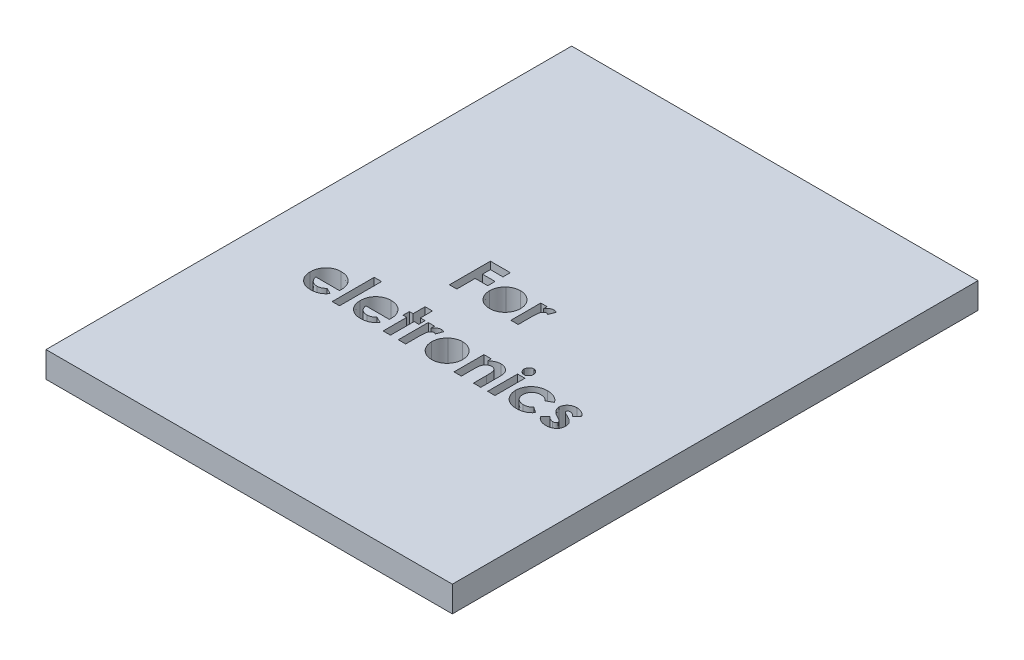
from build123d import *

# Parameters (mm, degrees)
SKETCH1_W           = 63
SKETCH1_H           = 81.5
BOSS_EXTRUDE1_DEPTH = 4
SKETCH2_W           = 1.13974359
SKETCH2_H           = 6.512820513
SKETCH2_H_2         = 4.640384616
CUT_EXTRUDE1_DEPTH  = 104.088554166


with BuildPart() as part:
    # Sketch1 → Boss-Extrude1 (new body)
    with BuildSketch(Plane(origin=(0, 0, 0), x_dir=(1, 0, 0), z_dir=(0, 1, 0))):
        with Locations((-31.5, 40.75)):
            Rectangle(SKETCH1_W, SKETCH1_H)
    extrude(amount=BOSS_EXTRUDE1_DEPTH)

    # Sketch2 → Cut-Extrude1 (cut, through all)
    # profile 1 of 14: a face of its own
    with BuildSketch(Plane(origin=(0, 4, 0), x_dir=(1, 0, 0), z_dir=(0, 1, 0))):
        Polygon((-40.419870072, 46.317161779), (-37.326280328, 46.317161779), (-37.326280328, 45.17741819), (-39.280126482, 45.17741819), (-39.280126482, 43.956264344), (-37.326280328, 43.956264344), (-37.326280328, 42.816520754), (-39.280126482, 42.816520754), (-39.280126482, 39.967161779), (-40.419870072, 39.967161779), align=None)
    # profile 2 of 14: a face of its own
    with BuildSketch(Plane(origin=(0, 4, 0), x_dir=(1, 0, 0), z_dir=(0, 1, 0))):
        with BuildLine():
            add(Edge.make_bspline(
                [(-34.138559975, 44.688956651), (-34.084675099, 44.687997733), (-33.977958627, 44.68609864), (-33.819017773, 44.670290428), (-33.662855572, 44.644498679), (-33.508574424, 44.611102865), (-33.357606973, 44.564310335), (-33.209161415, 44.50818993), (-33.061910456, 44.443757143), (-32.919508836, 44.367059589), (-32.780927811, 44.283874096), (-32.649544751, 44.192113673), (-32.526450703, 44.092499066), (-32.409360622, 43.987339917), (-32.303731094, 43.872057941), (-32.202811827, 43.752207907), (-32.112055243, 43.623496006), (-32.028027719, 43.48905865), (-31.953218619, 43.349673263), (-31.888260673, 43.20630946), (-31.831883284, 43.060949347), (-31.787740918, 42.911822339), (-31.751195108, 42.760894872), (-31.728132104, 42.606317444), (-31.711735907, 42.449677953), (-31.709897374, 42.344215358), (-31.708972636, 42.291170193)],
                knots=[0, 0, 0, 0, 1.022364134, 2.024744242, 3.027414945, 4.024939316, 5.017584196, 6.023349371, 7.035562955, 8.064994934, 9.090267829, 10.101425541, 11.102933353, 12.093946398, 13.084502048, 14.067315274, 15.065326281, 16.070028806, 17.074376865, 18.064572984, 19.055292013, 20.030201733, 21.013838017, 21.999348303, 22.993720005, 24, 24, 24, 24], degree=3))
            add(Edge.make_bspline(
                [(-31.708972636, 42.291170193), (-31.709948544, 42.237710612), (-31.71188887, 42.131420847), (-31.72753891, 41.973307969), (-31.753429382, 41.818003635), (-31.78695337, 41.664592923), (-31.83357079, 41.515038867), (-31.888038268, 41.367136984), (-31.954899241, 41.22290323), (-32.028818973, 41.080764152), (-32.113386758, 40.944902469), (-32.204064783, 40.814901185), (-32.30456135, 40.694170846), (-32.409345284, 40.578967267), (-32.523386723, 40.473186119), (-32.644865352, 40.375109797), (-32.772729505, 40.283539274), (-32.90789866, 40.200622968), (-33.048641525, 40.127767367), (-33.192584498, 40.062082097), (-33.340569278, 40.007394419), (-33.492289602, 39.962798124), (-33.647837484, 39.928268329), (-33.806869514, 39.904811829), (-33.969043195, 39.888498103), (-34.078309436, 39.886672944), (-34.133471834, 39.885751523)],
                knots=[0, 0, 0, 0, 1.012026251, 2.012137606, 3.004615893, 3.992048833, 4.982446996, 5.968083444, 6.973977695, 7.990229942, 8.999482246, 10.001782172, 10.988562221, 11.971415814, 12.948383116, 13.930088534, 14.925840678, 15.924049238, 16.929462851, 17.924729459, 18.917889337, 19.913673841, 20.916777188, 21.931792057, 22.95587778, 24, 24, 24, 24], degree=3))
            add(Edge.make_bspline(
                [(-34.133471834, 39.885751523), (-34.214130509, 39.888119014), (-34.373109984, 39.892785375), (-34.607249165, 39.924748728), (-34.832179627, 39.979766038), (-35.048267891, 40.056458955), (-35.255794662, 40.154738071), (-35.452948813, 40.276373401), (-35.641691489, 40.418970294), (-35.818753524, 40.581323508), (-35.980966336, 40.759439687), (-36.122678743, 40.949577622), (-36.243004044, 41.148887465), (-36.341833984, 41.357596498), (-36.418110544, 41.575990916), (-36.473195235, 41.803417797), (-36.505197667, 42.040516404), (-36.509824561, 42.201608038), (-36.512177764, 42.283537981)],
                knots=[0, 0, 0, 0, 1.029999031, 2.030143771, 3.011211297, 3.982305373, 4.953580601, 5.938004764, 6.935448627, 7.970290061, 9.001484052, 10.007591832, 10.993831261, 11.969999897, 12.951306496, 13.942897864, 14.953773953, 16, 16, 16, 16], degree=3))
            add(Edge.make_bspline(
                [(-36.512177764, 42.283537981), (-36.509742498, 42.371021201), (-36.504956032, 42.542967719), (-36.466949387, 42.794873285), (-36.406256874, 43.036060927), (-36.319136594, 43.265855966), (-36.207848099, 43.484682227), (-36.071990068, 43.692078182), (-35.910891083, 43.888090809), (-35.787521519, 44.006645965), (-35.72478794, 44.066931411)],
                knots=[0, 0, 0, 0, 1.043912699, 2.05178951, 3.033892, 4.007821512, 4.978932272, 5.95884105, 6.962068106, 8, 8, 8, 8], degree=3))
            add(Edge.make_bspline(
                [(-35.72478794, 44.066931411), (-35.667223611, 44.116901265), (-35.553661107, 44.215481442), (-35.369159413, 44.340514235), (-35.180250498, 44.448504423), (-34.984670207, 44.537292443), (-34.781873312, 44.604237178), (-34.572899034, 44.652966955), (-34.357790824, 44.682898212), (-34.212008293, 44.686926909), (-34.138559975, 44.688956651)],
                knots=[0, 0, 0, 0, 1.048115528, 2.067714963, 3.060638214, 4.039924844, 5.017819947, 5.994373833, 6.98952318, 8, 8, 8, 8], degree=3))
        make_face()
        with BuildLine():
            add(Edge.make_bspline(
                [(-34.11311927, 43.630623318), (-34.157247014, 43.629156658), (-34.244112954, 43.626269522), (-34.371981899, 43.610775033), (-34.492921693, 43.579017749), (-34.609334427, 43.538631174), (-34.719160748, 43.484619821), (-34.825408408, 43.421414091), (-34.922552761, 43.342319898), (-35.015294934, 43.255559354), (-35.099484155, 43.159214099), (-35.171221366, 43.054246015), (-35.235320153, 42.944670962), (-35.283923013, 42.82647726), (-35.324146526, 42.702895487), (-35.351369317, 42.571928936), (-35.370314479, 42.435040575), (-35.371720889, 42.34127111), (-35.372434174, 42.293714263)],
                knots=[0, 0, 0, 0, 1.030650113, 2.02884584, 2.99876339, 3.944280128, 4.900564847, 5.851248946, 6.823638398, 7.81794922, 8.81432732, 9.802856497, 10.78262424, 11.771747962, 12.779760563, 13.812642396, 14.89064281, 16, 16, 16, 16], degree=3))
            add(Edge.make_bspline(
                [(-35.372434174, 42.293714263), (-35.371599533, 42.244480323), (-35.369968387, 42.148262041), (-35.353077528, 42.007770411), (-35.325223946, 41.874444784), (-35.285652735, 41.748491122), (-35.235885255, 41.629005343), (-35.174826328, 41.516657844), (-35.101831546, 41.412124127), (-35.01907318, 41.315532918), (-34.928456304, 41.227856008), (-34.829165415, 41.152614964), (-34.725358443, 41.087240484), (-34.61464311, 41.034734686), (-34.498591893, 40.99419595), (-34.376860282, 40.964348642), (-34.248808579, 40.948268359), (-34.161497555, 40.945498533), (-34.116935376, 40.944084856)],
                knots=[0, 0, 0, 0, 1.141730614, 2.231293227, 3.276944405, 4.297399982, 5.28939179, 6.275415646, 7.257752684, 8.24146775, 9.222424823, 10.176631434, 11.126518621, 12.063689483, 13.012557477, 13.974037417, 14.965980454, 16, 16, 16, 16], degree=3))
            add(Edge.make_bspline(
                [(-34.116935376, 40.944084856), (-34.07235091, 40.945338723), (-33.984939474, 40.94779703), (-33.856737398, 40.966205867), (-33.734384137, 40.995177747), (-33.617341751, 41.036065386), (-33.50655654, 41.089695043), (-33.401604408, 41.155382283), (-33.301562078, 41.231669862), (-33.209729114, 41.321001068), (-33.124721096, 41.417893511), (-33.050174149, 41.522979055), (-32.987879908, 41.635326582), (-32.936787477, 41.754229203), (-32.897138692, 41.879523485), (-32.869746231, 42.011675133), (-32.850790941, 42.150274597), (-32.849416338, 42.245310547), (-32.848716225, 42.293714263)],
                knots=[0, 0, 0, 0, 1.031504075, 2.022346795, 2.991027682, 3.937587355, 4.885570121, 5.833146507, 6.798790848, 7.791235734, 8.792807298, 9.778388351, 10.766749885, 11.760164525, 12.768777521, 13.802286646, 14.880660483, 16, 16, 16, 16], degree=3))
            add(Edge.make_bspline(
                [(-32.848716225, 42.293714263), (-32.849561484, 42.342101063), (-32.851220157, 42.437051659), (-32.868112219, 42.575838577), (-32.895692454, 42.707563074), (-32.935774047, 42.831662695), (-32.985245716, 42.949553222), (-33.046346846, 43.060631217), (-33.119701615, 43.164349591), (-33.202862293, 43.260194052), (-33.294837573, 43.346640656), (-33.392404532, 43.423730041), (-33.497794227, 43.487488885), (-33.609029485, 43.540048932), (-33.726406248, 43.580486386), (-33.849792742, 43.610502846), (-33.979567109, 43.626354313), (-34.068136623, 43.629185444), (-34.11311927, 43.630623318)],
                knots=[0, 0, 0, 0, 1.123894411, 2.205445421, 3.243160173, 4.246488011, 5.231014757, 6.210004299, 7.185865357, 8.177612767, 9.153374344, 10.115157457, 11.061423229, 12.009021698, 12.96873347, 13.94135618, 14.954456845, 16, 16, 16, 16], degree=3))
        make_face(mode=Mode.SUBTRACT)
    # profile 3 of 14: a face of its own
    with BuildSketch(Plane(origin=(0, 4, 0), x_dir=(1, 0, 0), z_dir=(0, 1, 0))):
        with BuildLine():
            Line((-30.894870072, 44.607546395), (-29.917946995, 44.607546395))
            Line((-29.917946995, 44.607546395), (-29.917946995, 44.036402565))
            add(Edge.make_bspline(
                [(-29.917946995, 44.036402565), (-29.890311716, 44.087160274), (-29.836297418, 44.186368323), (-29.737068622, 44.319535482), (-29.623070563, 44.431685147), (-29.498399542, 44.525163032), (-29.362677707, 44.598019865), (-29.219539446, 44.649939543), (-29.070209306, 44.68368014), (-28.968341346, 44.687185149), (-28.916855248, 44.688956651)],
                knots=[0, 0, 0, 0, 1.09866127, 2.147379032, 3.14564304, 4.131443017, 5.102343063, 6.064490016, 7.021754664, 8, 8, 8, 8], degree=3))
            add(Edge.make_bspline(
                [(-28.916855248, 44.688956651), (-28.879469916, 44.687206037), (-28.803340032, 44.683641162), (-28.687307375, 44.662918489), (-28.569600571, 44.625447954), (-28.492139351, 44.591710718), (-28.452562379, 44.574473478)],
                knots=[0, 0, 0, 0, 0.931404136, 1.896671404, 2.925354185, 4, 4, 4, 4], degree=3))
            Line((-28.452562379, 44.574473478), (-28.806188181, 43.608998719))
            add(Edge.make_bspline(
                [(-28.806188181, 43.608998719), (-28.837797277, 43.624270706), (-28.897210212, 43.652976163), (-28.983467476, 43.68685156), (-29.061749519, 43.707520671), (-29.111378898, 43.710604684), (-29.134373277, 43.712033574)],
                knots=[0, 0, 0, 0, 1.214386998, 2.282580073, 3.20428172, 4, 4, 4, 4], degree=3))
            add(Edge.make_bspline(
                [(-29.134373277, 43.712033574), (-29.156084442, 43.711086716), (-29.198794044, 43.709224082), (-29.261832222, 43.693261945), (-29.321201059, 43.665735734), (-29.379761536, 43.630471925), (-29.43289388, 43.581452594), (-29.485993405, 43.524704015), (-29.53278755, 43.454640346), (-29.582168944, 43.376655923), (-29.624215435, 43.281203061), (-29.660269006, 43.167252013), (-29.692393028, 43.033484289), (-29.71449874, 42.879189647), (-29.735864799, 42.705861154), (-29.748582402, 42.512226601), (-29.758060992, 42.298898278), (-29.758640545, 42.149987409), (-29.758942588, 42.072380129)],
                knots=[0, 0, 0, 0, 0.544232178, 1.070598461, 1.618251235, 2.182094276, 2.777567932, 3.425210017, 4.127676488, 4.886675562, 5.738955394, 6.734782583, 7.883056018, 9.186093582, 10.642914445, 12.264202625, 14.053029461, 16, 16, 16, 16], degree=3))
            Line((-29.758942588, 42.072380129), (-29.755126482, 41.845957853))
            Line((-29.755126482, 41.845957853), (-29.755126482, 39.967161779))
            Line((-29.755126482, 39.967161779), (-30.894870072, 39.967161779))
            Line((-30.894870072, 39.967161779), (-30.894870072, 44.607546395))
        make_face()
    # profile 4 of 14: a face of its own
    with BuildSketch(Plane(origin=(0, 4, 0), x_dir=(1, 0, 0), z_dir=(0, 1, 0))):
        with BuildLine():
            Line((-48.157660536, 30.663315626), (-51.817305969, 30.663315626))
            add(Edge.make_bspline(
                [(-51.817305969, 30.663315626), (-51.809844248, 30.620792622), (-51.795181376, 30.537231565), (-51.763340429, 30.415851878), (-51.722706606, 30.30146571), (-51.674009527, 30.193920155), (-51.618070226, 30.092646661), (-51.552821666, 29.99812024), (-51.479091465, 29.910424386), (-51.397305912, 29.829940231), (-51.308828223, 29.757824685), (-51.214087482, 29.694646908), (-51.112985924, 29.642844995), (-51.006682639, 29.599181358), (-50.894383297, 29.564595334), (-50.775922621, 29.540742011), (-50.651614634, 29.526651766), (-50.566932236, 29.524613773), (-50.523646113, 29.523572036)],
                knots=[0, 0, 0, 0, 1.091296461, 2.144483647, 3.168565212, 4.157007626, 5.126487748, 6.090021542, 7.05641414, 8.019231907, 8.98705074, 9.938580405, 10.892824166, 11.854447369, 12.841318655, 13.858982407, 14.905600794, 16, 16, 16, 16], degree=3))
            add(Edge.make_bspline(
                [(-50.523646113, 29.523572036), (-50.471396825, 29.524951468), (-50.36850259, 29.527667975), (-50.217761768, 29.551759359), (-50.071973436, 29.588148336), (-49.932517264, 29.6422618), (-49.797777872, 29.709623549), (-49.669973484, 29.793548), (-49.546891905, 29.891582607), (-49.471797638, 29.967147644), (-49.433511899, 30.005673398)],
                knots=[0, 0, 0, 0, 1.021034703, 2.010718019, 2.977989445, 3.954245119, 4.929443971, 5.918328161, 6.938689359, 8, 8, 8, 8], degree=3))
            Line((-49.433511899, 30.005673398), (-48.479485456, 29.551556812))
            add(Edge.make_bspline(
                [(-48.479485456, 29.551556812), (-48.509522422, 29.510050335), (-48.569039565, 29.427806778), (-48.666199304, 29.312068852), (-48.767591678, 29.204080672), (-48.873292305, 29.104552492), (-48.983435241, 29.013767929), (-49.097714095, 28.930621062), (-49.217799005, 28.857344352), (-49.341288895, 28.790392715), (-49.470736529, 28.732995388), (-49.605783669, 28.684048972), (-49.745858315, 28.63980183), (-49.892729307, 28.606087931), (-50.04517365, 28.579400283), (-50.203556023, 28.560448518), (-50.36785555, 28.548742921), (-50.479528981, 28.547355237), (-50.536366466, 28.546648959)],
                knots=[0, 0, 0, 0, 1.028154879, 2.037251081, 3.030720504, 4.000128189, 4.949298328, 5.894184978, 6.834267904, 7.770992897, 8.712077017, 9.673380525, 10.653304757, 11.658697181, 12.695551717, 13.758623199, 14.859225354, 16, 16, 16, 16], degree=3))
            add(Edge.make_bspline(
                [(-50.536366466, 28.546648959), (-50.623810003, 28.54843167), (-50.795063129, 28.551923006), (-51.045551785, 28.584327601), (-51.283446532, 28.638057912), (-51.509419103, 28.711096018), (-51.722492693, 28.8075292), (-51.922772753, 28.92547498), (-52.112260367, 29.062672103), (-52.285165631, 29.22199997), (-52.442687428, 29.395418881), (-52.58104478, 29.58165895), (-52.696820243, 29.779418987), (-52.791897381, 29.987390175), (-52.865794635, 30.206104838), (-52.91907027, 30.43565842), (-52.951728872, 30.675941281), (-52.955256163, 30.839600732), (-52.957049559, 30.922810818)],
                knots=[0, 0, 0, 0, 1.103565453, 2.161269334, 3.182010356, 4.179077853, 5.15417608, 6.128274628, 7.109042802, 8.101804412, 9.090965879, 10.063106201, 11.02526161, 11.978650795, 12.945248442, 13.93468508, 14.949922959, 16, 16, 16, 16], degree=3))
            add(Edge.make_bspline(
                [(-52.957049559, 30.922810818), (-52.955238512, 31.008135379), (-52.951675359, 31.176007621), (-52.91935146, 31.421838723), (-52.865647347, 31.656394845), (-52.791533926, 31.879998995), (-52.69789912, 32.09335051), (-52.580650614, 32.294582821), (-52.442756087, 32.48439651), (-52.28580176, 32.661903607), (-52.112164015, 32.822123156), (-51.927657507, 32.964910793), (-51.730209115, 33.08389093), (-51.522052151, 33.180026806), (-51.304518062, 33.258134779), (-51.075092458, 33.310109112), (-50.835520917, 33.345006765), (-50.671755087, 33.348220621), (-50.588519911, 33.349854087)],
                knots=[0, 0, 0, 0, 1.079208495, 2.12329425, 3.130605359, 4.119693003, 5.099659317, 6.073216462, 7.060498243, 8.06384408, 9.066070512, 10.045757761, 11.010926815, 11.975797609, 12.942977511, 13.929384301, 14.947594487, 16, 16, 16, 16], degree=3))
            add(Edge.make_bspline(
                [(-50.588519911, 33.349854087), (-50.500657461, 33.348043719), (-50.328148594, 33.344489248), (-50.075915362, 33.312347771), (-49.836441023, 33.258289818), (-49.608705281, 33.185883259), (-49.395616415, 33.087014074), (-49.192492216, 32.971970753), (-49.004204756, 32.83180801), (-48.82874709, 32.673259842), (-48.670360688, 32.497356144), (-48.531913423, 32.306270853), (-48.41411184, 32.101868849), (-48.318632488, 31.883321237), (-48.244811112, 31.65128412), (-48.191486162, 31.406058844), (-48.159076667, 31.146712688), (-48.155615011, 30.969123511), (-48.153844431, 30.878289584)],
                knots=[0, 0, 0, 0, 1.080001299, 2.120471247, 3.119684163, 4.095710327, 5.052285597, 6.002875087, 6.961153713, 7.931888285, 8.906493152, 9.865905668, 10.82813294, 11.801621613, 12.7925306, 13.817193356, 14.883530496, 16, 16, 16, 16], degree=3))
            Line((-48.153844431, 30.878289584), (-48.157660536, 30.663315626))
        make_face()
        with BuildLine():
            add(Edge.make_bspline(
                [(-49.29358802, 31.558828446), (-49.315095679, 31.616868904), (-49.357858507, 31.732268455), (-49.454457956, 31.891491677), (-49.582642334, 32.029385454), (-49.731729962, 32.151463908), (-49.902071911, 32.250550407), (-50.08830041, 32.322292251), (-50.288061566, 32.36530956), (-50.425486476, 32.370354735), (-50.495661338, 32.37293101)],
                knots=[0, 0, 0, 0, 0.954238005, 1.897273737, 2.851915805, 3.847685534, 4.862635127, 5.880135777, 6.917509367, 8, 8, 8, 8], degree=3))
            add(Edge.make_bspline(
                [(-50.495661338, 32.37293101), (-50.572303712, 32.370456184), (-50.722123595, 32.365618414), (-50.938228576, 32.314166953), (-51.142074998, 32.237377184), (-51.262251294, 32.158205302), (-51.322484254, 32.118523959)],
                knots=[0, 0, 0, 0, 1.044195649, 2.041185066, 3.018232172, 4, 4, 4, 4], degree=3))
            add(Edge.make_bspline(
                [(-51.322484254, 32.118523959), (-51.360065123, 32.088301779), (-51.440185613, 32.023869637), (-51.544238325, 31.89533363), (-51.646731112, 31.73970538), (-51.705003913, 31.621494729), (-51.735895713, 31.558828446)],
                knots=[0, 0, 0, 0, 0.82159062, 1.751589201, 2.808063854, 4, 4, 4, 4], degree=3))
            Line((-51.735895713, 31.558828446), (-49.29358802, 31.558828446))
        make_face(mode=Mode.SUBTRACT)
    # profile 5 of 14: a face of its own
    with BuildSketch(Plane(origin=(0, 4, 0), x_dir=(1, 0, 0), z_dir=(0, 1, 0))):
        with Locations((-46.688459815, 31.884469472)):
            Rectangle(SKETCH2_W, SKETCH2_H)
    # profile 6 of 14: a face of its own
    with BuildSketch(Plane(origin=(0, 4, 0), x_dir=(1, 0, 0), z_dir=(0, 1, 0))):
        with BuildLine():
            Line((-40.423686177, 30.663315626), (-44.08333161, 30.663315626))
            add(Edge.make_bspline(
                [(-44.08333161, 30.663315626), (-44.075869889, 30.620792622), (-44.061207017, 30.537231565), (-44.02936607, 30.415851878), (-43.988732247, 30.30146571), (-43.940035168, 30.193920155), (-43.884095867, 30.092646661), (-43.818847307, 29.99812024), (-43.745117106, 29.910424386), (-43.663331553, 29.829940231), (-43.574853864, 29.757824685), (-43.480113123, 29.694646908), (-43.379011565, 29.642844995), (-43.27270828, 29.599181358), (-43.160408938, 29.564595334), (-43.041948262, 29.540742011), (-42.917640275, 29.526651766), (-42.832957877, 29.524613773), (-42.789671754, 29.523572036)],
                knots=[0, 0, 0, 0, 1.091296461, 2.144483647, 3.168565212, 4.157007626, 5.126487748, 6.090021542, 7.05641414, 8.019231907, 8.98705074, 9.938580405, 10.892824166, 11.854447369, 12.841318655, 13.858982407, 14.905600794, 16, 16, 16, 16], degree=3))
            add(Edge.make_bspline(
                [(-42.789671754, 29.523572036), (-42.737422466, 29.524951468), (-42.634528231, 29.527667975), (-42.483787409, 29.551759359), (-42.337999077, 29.588148336), (-42.198542905, 29.6422618), (-42.063803513, 29.709623549), (-41.935999125, 29.793548), (-41.812917546, 29.891582607), (-41.737823279, 29.967147644), (-41.69953754, 30.005673398)],
                knots=[0, 0, 0, 0, 1.021034703, 2.010718019, 2.977989445, 3.954245119, 4.929443971, 5.918328161, 6.938689359, 8, 8, 8, 8], degree=3))
            Line((-41.69953754, 30.005673398), (-40.745511097, 29.551556812))
            add(Edge.make_bspline(
                [(-40.745511097, 29.551556812), (-40.775548063, 29.510050335), (-40.835065206, 29.427806778), (-40.932224945, 29.312068852), (-41.033617319, 29.204080672), (-41.139317946, 29.104552492), (-41.249460882, 29.013767929), (-41.363739736, 28.930621062), (-41.483824646, 28.857344352), (-41.607314536, 28.790392715), (-41.73676217, 28.732995388), (-41.87180931, 28.684048972), (-42.011883956, 28.63980183), (-42.158754948, 28.606087931), (-42.311199291, 28.579400283), (-42.469581664, 28.560448518), (-42.633881191, 28.548742921), (-42.745554622, 28.547355237), (-42.802392107, 28.546648959)],
                knots=[0, 0, 0, 0, 1.028154879, 2.037251081, 3.030720504, 4.000128189, 4.949298328, 5.894184978, 6.834267904, 7.770992897, 8.712077017, 9.673380525, 10.653304757, 11.658697181, 12.695551717, 13.758623199, 14.859225354, 16, 16, 16, 16], degree=3))
            add(Edge.make_bspline(
                [(-42.802392107, 28.546648959), (-42.889835644, 28.54843167), (-43.06108877, 28.551923006), (-43.311577426, 28.584327601), (-43.549472173, 28.638057912), (-43.775444744, 28.711096018), (-43.988518334, 28.8075292), (-44.188798394, 28.92547498), (-44.378286008, 29.062672103), (-44.551191272, 29.22199997), (-44.708713069, 29.395418881), (-44.847070422, 29.58165895), (-44.962845884, 29.779418987), (-45.057923022, 29.987390175), (-45.131820276, 30.206104838), (-45.185095911, 30.43565842), (-45.217754513, 30.675941281), (-45.221281804, 30.839600732), (-45.2230752, 30.922810818)],
                knots=[0, 0, 0, 0, 1.103565453, 2.161269334, 3.182010356, 4.179077853, 5.15417608, 6.128274628, 7.109042802, 8.101804412, 9.090965879, 10.063106201, 11.02526161, 11.978650795, 12.945248442, 13.93468508, 14.949922959, 16, 16, 16, 16], degree=3))
            add(Edge.make_bspline(
                [(-45.2230752, 30.922810818), (-45.221264153, 31.008135379), (-45.217701, 31.176007621), (-45.185377101, 31.421838723), (-45.131672988, 31.656394845), (-45.057559567, 31.879998995), (-44.963924761, 32.09335051), (-44.846676255, 32.294582821), (-44.708781728, 32.48439651), (-44.551827401, 32.661903607), (-44.378189656, 32.822123156), (-44.193683148, 32.964910793), (-43.996234756, 33.08389093), (-43.788077792, 33.180026806), (-43.570543703, 33.258134779), (-43.341118099, 33.310109112), (-43.101546558, 33.345006765), (-42.937780728, 33.348220621), (-42.854545552, 33.349854087)],
                knots=[0, 0, 0, 0, 1.079208495, 2.12329425, 3.130605359, 4.119693003, 5.099659317, 6.073216462, 7.060498243, 8.06384408, 9.066070512, 10.045757761, 11.010926815, 11.975797609, 12.942977511, 13.929384301, 14.947594487, 16, 16, 16, 16], degree=3))
            add(Edge.make_bspline(
                [(-42.854545552, 33.349854087), (-42.766683102, 33.348043719), (-42.594174235, 33.344489248), (-42.341941003, 33.312347771), (-42.102466664, 33.258289818), (-41.874730922, 33.185883259), (-41.661642056, 33.087014074), (-41.458517858, 32.971970753), (-41.270230397, 32.83180801), (-41.094772731, 32.673259842), (-40.936386329, 32.497356144), (-40.797939064, 32.306270853), (-40.680137481, 32.101868849), (-40.584658129, 31.883321237), (-40.510836753, 31.65128412), (-40.457511803, 31.406058844), (-40.425102308, 31.146712688), (-40.421640652, 30.969123511), (-40.419870072, 30.878289584)],
                knots=[0, 0, 0, 0, 1.080001299, 2.120471247, 3.119684163, 4.095710327, 5.052285597, 6.002875087, 6.961153713, 7.931888285, 8.906493152, 9.865905668, 10.82813294, 11.801621613, 12.7925306, 13.817193356, 14.883530496, 16, 16, 16, 16], degree=3))
            Line((-40.419870072, 30.878289584), (-40.423686177, 30.663315626))
        make_face()
        with BuildLine():
            add(Edge.make_bspline(
                [(-41.559613661, 31.558828446), (-41.58112132, 31.616868904), (-41.623884148, 31.732268455), (-41.720483597, 31.891491677), (-41.848667975, 32.029385454), (-41.997755603, 32.151463908), (-42.168097552, 32.250550407), (-42.354326051, 32.322292251), (-42.554087207, 32.36530956), (-42.691512117, 32.370354735), (-42.761686979, 32.37293101)],
                knots=[0, 0, 0, 0, 0.954238005, 1.897273737, 2.851915805, 3.847685534, 4.862635127, 5.880135777, 6.917509367, 8, 8, 8, 8], degree=3))
            add(Edge.make_bspline(
                [(-42.761686979, 32.37293101), (-42.838329353, 32.370456184), (-42.988149236, 32.365618414), (-43.204254217, 32.314166953), (-43.408100639, 32.237377184), (-43.528276935, 32.158205302), (-43.588509895, 32.118523959)],
                knots=[0, 0, 0, 0, 1.044195649, 2.041185066, 3.018232172, 4, 4, 4, 4], degree=3))
            add(Edge.make_bspline(
                [(-43.588509895, 32.118523959), (-43.626090764, 32.088301779), (-43.706211254, 32.023869637), (-43.810263966, 31.89533363), (-43.912756753, 31.73970538), (-43.971029554, 31.621494729), (-44.001921354, 31.558828446)],
                knots=[0, 0, 0, 0, 0.82159062, 1.751589201, 2.808063854, 4, 4, 4, 4], degree=3))
            Line((-44.001921354, 31.558828446), (-41.559613661, 31.558828446))
        make_face(mode=Mode.SUBTRACT)
    # profile 7 of 14: a face of its own
    with BuildSketch(Plane(origin=(0, 4, 0), x_dir=(1, 0, 0), z_dir=(0, 1, 0))):
        Polygon((-39.361536738, 35.140879728), (-38.221793149, 35.140879728), (-38.221793149, 33.268443831), (-37.489100841, 33.268443831), (-37.489100841, 32.291520754), (-38.221793149, 32.291520754), (-38.221793149, 28.628059215), (-39.361536738, 28.628059215), (-39.361536738, 32.291520754), (-39.931408533, 32.291520754), (-39.931408533, 33.268443831), (-39.361536738, 33.268443831), align=None)
    # profile 8 of 14: a face of its own
    with BuildSketch(Plane(origin=(0, 4, 0), x_dir=(1, 0, 0), z_dir=(0, 1, 0))):
        with BuildLine():
            Line((-37.000639302, 33.268443831), (-36.023716225, 33.268443831))
            Line((-36.023716225, 33.268443831), (-36.023716225, 32.697300001))
            add(Edge.make_bspline(
                [(-36.023716225, 32.697300001), (-35.996080947, 32.74805771), (-35.942066649, 32.847265759), (-35.842837853, 32.980432917), (-35.728839794, 33.092582583), (-35.604168773, 33.186060468), (-35.468446938, 33.258917301), (-35.325308677, 33.310836979), (-35.175978536, 33.344577575), (-35.074110577, 33.348082585), (-35.022624479, 33.349854087)],
                knots=[0, 0, 0, 0, 1.09866127, 2.147379032, 3.14564304, 4.131443017, 5.102343063, 6.064490016, 7.021754664, 8, 8, 8, 8], degree=3))
            add(Edge.make_bspline(
                [(-35.022624479, 33.349854087), (-34.985239147, 33.348103473), (-34.909109263, 33.344538598), (-34.793076606, 33.323815924), (-34.675369802, 33.28634539), (-34.597908582, 33.252608154), (-34.55833161, 33.235370914)],
                knots=[0, 0, 0, 0, 0.931404136, 1.896671404, 2.925354185, 4, 4, 4, 4], degree=3))
            Line((-34.55833161, 33.235370914), (-34.911957411, 32.269896154))
            add(Edge.make_bspline(
                [(-34.911957411, 32.269896154), (-34.943566508, 32.285168142), (-35.002979442, 32.313873599), (-35.089236706, 32.347748996), (-35.16751875, 32.368418107), (-35.217148129, 32.37150212), (-35.240142508, 32.37293101)],
                knots=[0, 0, 0, 0, 1.214386998, 2.282580073, 3.20428172, 4, 4, 4, 4], degree=3))
            add(Edge.make_bspline(
                [(-35.240142508, 32.37293101), (-35.261853673, 32.371984152), (-35.304563275, 32.370121518), (-35.367601453, 32.354159381), (-35.42697029, 32.32663317), (-35.485530767, 32.291369361), (-35.538663111, 32.24235003), (-35.591762636, 32.185601451), (-35.638556781, 32.115537782), (-35.687938174, 32.037553359), (-35.729984665, 31.942100497), (-35.766038237, 31.828149449), (-35.798162258, 31.694381725), (-35.820267971, 31.540087083), (-35.84163403, 31.36675859), (-35.854351633, 31.173124037), (-35.863830223, 30.959795714), (-35.864409775, 30.810884845), (-35.864711818, 30.733277565)],
                knots=[0, 0, 0, 0, 0.544232178, 1.070598461, 1.618251235, 2.182094276, 2.777567932, 3.425210017, 4.127676488, 4.886675562, 5.738955394, 6.734782583, 7.883056018, 9.186093582, 10.642914445, 12.264202625, 14.053029461, 16, 16, 16, 16], degree=3))
            Line((-35.864711818, 30.733277565), (-35.860895713, 30.506855289))
            Line((-35.860895713, 30.506855289), (-35.860895713, 28.628059215))
            Line((-35.860895713, 28.628059215), (-37.000639302, 28.628059215))
            Line((-37.000639302, 28.628059215), (-37.000639302, 33.268443831))
        make_face()
    # profile 9 of 14: a face of its own
    with BuildSketch(Plane(origin=(0, 4, 0), x_dir=(1, 0, 0), z_dir=(0, 1, 0))):
        with BuildLine():
            add(Edge.make_bspline(
                [(-31.77766254, 33.349854087), (-31.723777663, 33.348895169), (-31.617061191, 33.346996076), (-31.458120337, 33.331187864), (-31.301958136, 33.305396115), (-31.147676988, 33.272000301), (-30.996709537, 33.225207771), (-30.848263979, 33.169087366), (-30.70101302, 33.104654579), (-30.558611401, 33.027957025), (-30.420030375, 32.944771532), (-30.288647315, 32.853011109), (-30.165553267, 32.753396501), (-30.048463186, 32.648237353), (-29.942833659, 32.532955377), (-29.841914391, 32.413105343), (-29.751157807, 32.284393442), (-29.667130283, 32.149956086), (-29.592321183, 32.010570699), (-29.527363237, 31.867206896), (-29.470985848, 31.721846783), (-29.426843482, 31.572719774), (-29.390297672, 31.421792308), (-29.367234668, 31.26721488), (-29.350838471, 31.110575389), (-29.348999938, 31.005112794), (-29.3480752, 30.952067629)],
                knots=[0, 0, 0, 0, 1.022364134, 2.024744242, 3.027414945, 4.024939316, 5.017584196, 6.023349371, 7.035562955, 8.064994934, 9.090267829, 10.101425541, 11.102933353, 12.093946398, 13.084502048, 14.067315274, 15.065326281, 16.070028806, 17.074376865, 18.064572984, 19.055292013, 20.030201733, 21.013838017, 21.999348303, 22.993720005, 24, 24, 24, 24], degree=3))
            add(Edge.make_bspline(
                [(-29.3480752, 30.952067629), (-29.349051108, 30.898608048), (-29.350991434, 30.792318283), (-29.366641474, 30.634205405), (-29.392531946, 30.478901071), (-29.426055935, 30.325490358), (-29.472673354, 30.175936303), (-29.527140832, 30.02803442), (-29.594001805, 29.883800666), (-29.667921537, 29.741661588), (-29.752489322, 29.605799904), (-29.843167347, 29.475798621), (-29.943663914, 29.355068282), (-30.048447848, 29.239864703), (-30.162489287, 29.134083555), (-30.283967916, 29.036007233), (-30.41183207, 28.94443671), (-30.547001224, 28.861520404), (-30.687744089, 28.788664803), (-30.831687062, 28.722979533), (-30.979671842, 28.668291855), (-31.131392166, 28.62369556), (-31.286940048, 28.589165765), (-31.445972078, 28.565709265), (-31.60814576, 28.549395539), (-31.717412, 28.54757038), (-31.772574399, 28.546648959)],
                knots=[0, 0, 0, 0, 1.012026251, 2.012137606, 3.004615893, 3.992048833, 4.982446996, 5.968083444, 6.973977695, 7.990229942, 8.999482246, 10.001782172, 10.988562221, 11.971415814, 12.948383116, 13.930088534, 14.925840678, 15.924049238, 16.929462851, 17.924729459, 18.917889337, 19.913673841, 20.916777188, 21.931792057, 22.95587778, 24, 24, 24, 24], degree=3))
            add(Edge.make_bspline(
                [(-31.772574399, 28.546648959), (-31.853233073, 28.54901645), (-32.012212548, 28.553682811), (-32.246351729, 28.585646164), (-32.471282191, 28.640663474), (-32.687370455, 28.717356391), (-32.894897227, 28.815635507), (-33.092051377, 28.937270837), (-33.280794053, 29.07986773), (-33.457856088, 29.242220944), (-33.6200689, 29.420337123), (-33.761781307, 29.610475058), (-33.882106608, 29.809784901), (-33.980936548, 30.018493934), (-34.057213108, 30.236888352), (-34.112297799, 30.464315233), (-34.144300231, 30.70141384), (-34.148927126, 30.862505473), (-34.151280328, 30.944435417)],
                knots=[0, 0, 0, 0, 1.029999031, 2.030143771, 3.011211297, 3.982305373, 4.953580601, 5.938004764, 6.935448627, 7.970290061, 9.001484052, 10.007591832, 10.993831261, 11.969999897, 12.951306496, 13.942897864, 14.953773953, 16, 16, 16, 16], degree=3))
            add(Edge.make_bspline(
                [(-34.151280328, 30.944435417), (-34.148845062, 31.031918637), (-34.144058596, 31.203865155), (-34.106051951, 31.455770721), (-34.045359438, 31.696958363), (-33.958239158, 31.926753401), (-33.846950663, 32.145579663), (-33.711092632, 32.352975618), (-33.549993647, 32.548988244), (-33.426624083, 32.667543401), (-33.363890504, 32.727828847)],
                knots=[0, 0, 0, 0, 1.043912699, 2.05178951, 3.033892, 4.007821512, 4.978932272, 5.95884105, 6.962068106, 8, 8, 8, 8], degree=3))
            add(Edge.make_bspline(
                [(-33.363890504, 32.727828847), (-33.306326175, 32.777798701), (-33.192763671, 32.876378878), (-33.008261977, 33.001411671), (-32.819353062, 33.109401859), (-32.623772771, 33.198189879), (-32.420975876, 33.265134614), (-32.212001598, 33.313864391), (-31.996893388, 33.343795648), (-31.851110857, 33.347824345), (-31.77766254, 33.349854087)],
                knots=[0, 0, 0, 0, 1.048115528, 2.067714963, 3.060638214, 4.039924844, 5.017819947, 5.994373833, 6.98952318, 8, 8, 8, 8], degree=3))
        make_face()
        with BuildLine():
            add(Edge.make_bspline(
                [(-31.752221834, 32.291520754), (-31.796349579, 32.290054094), (-31.883215518, 32.287166958), (-32.011084463, 32.271672469), (-32.132024257, 32.239915185), (-32.248436991, 32.19952861), (-32.358263312, 32.145517257), (-32.464510972, 32.082311527), (-32.561655325, 32.003217334), (-32.654397498, 31.91645679), (-32.73858672, 31.820111534), (-32.81032393, 31.715143451), (-32.874422717, 31.605568398), (-32.923025577, 31.487374696), (-32.96324909, 31.363792922), (-32.990471881, 31.232826372), (-33.009417043, 31.095938011), (-33.010823453, 31.002168546), (-33.011536738, 30.954611699)],
                knots=[0, 0, 0, 0, 1.030650113, 2.02884584, 2.99876339, 3.944280128, 4.900564847, 5.851248946, 6.823638398, 7.81794922, 8.81432732, 9.802856497, 10.78262424, 11.771747962, 12.779760563, 13.812642396, 14.89064281, 16, 16, 16, 16], degree=3))
            add(Edge.make_bspline(
                [(-33.011536738, 30.954611699), (-33.010702097, 30.905377759), (-33.009070951, 30.809159477), (-32.992180093, 30.668667846), (-32.96432651, 30.53534222), (-32.924755299, 30.409388558), (-32.874987819, 30.289902779), (-32.813928892, 30.17755528), (-32.74093411, 30.073021563), (-32.658175744, 29.976430353), (-32.567558868, 29.888753444), (-32.468267979, 29.8135124), (-32.364461007, 29.74813792), (-32.253745674, 29.695632122), (-32.137694457, 29.655093385), (-32.015962846, 29.625246078), (-31.887911143, 29.609165795), (-31.800600119, 29.606395968), (-31.75603794, 29.604982292)],
                knots=[0, 0, 0, 0, 1.141730614, 2.231293227, 3.276944405, 4.297399982, 5.28939179, 6.275415646, 7.257752684, 8.24146775, 9.222424823, 10.176631434, 11.126518621, 12.063689483, 13.012557477, 13.974037417, 14.965980454, 16, 16, 16, 16], degree=3))
            add(Edge.make_bspline(
                [(-31.75603794, 29.604982292), (-31.711453474, 29.606236159), (-31.624042038, 29.608694466), (-31.495839962, 29.627103303), (-31.373486701, 29.656075183), (-31.256444315, 29.696962822), (-31.145659104, 29.750592478), (-31.040706972, 29.816279719), (-30.940664642, 29.892567298), (-30.848831678, 29.981898504), (-30.76382366, 30.078790947), (-30.689276713, 30.183876491), (-30.626982473, 30.296224018), (-30.575890041, 30.415126639), (-30.536241256, 30.540420921), (-30.508848795, 30.672572569), (-30.489893505, 30.811172033), (-30.488518902, 30.906207983), (-30.48781879, 30.954611699)],
                knots=[0, 0, 0, 0, 1.031504075, 2.022346795, 2.991027682, 3.937587355, 4.885570121, 5.833146507, 6.798790848, 7.791235734, 8.792807298, 9.778388351, 10.766749885, 11.760164525, 12.768777521, 13.802286646, 14.880660483, 16, 16, 16, 16], degree=3))
            add(Edge.make_bspline(
                [(-30.48781879, 30.954611699), (-30.488664048, 31.002998498), (-30.490322721, 31.097949095), (-30.507214783, 31.236736013), (-30.534795018, 31.36846051), (-30.574876611, 31.492560131), (-30.62434828, 31.610450658), (-30.68544941, 31.721528653), (-30.758804179, 31.825247027), (-30.841964857, 31.921091488), (-30.933940137, 32.007538092), (-31.031507096, 32.084627477), (-31.136896791, 32.148386321), (-31.248132049, 32.200946368), (-31.365508812, 32.241383822), (-31.488895306, 32.271400282), (-31.618669673, 32.287251749), (-31.707239187, 32.29008288), (-31.752221834, 32.291520754)],
                knots=[0, 0, 0, 0, 1.123894411, 2.205445421, 3.243160173, 4.246488011, 5.231014757, 6.210004299, 7.185865357, 8.177612767, 9.153374344, 10.115157457, 11.061423229, 12.009021698, 12.96873347, 13.94135618, 14.954456845, 16, 16, 16, 16], degree=3))
        make_face(mode=Mode.SUBTRACT)
    # profile 10 of 14: a face of its own
    with BuildSketch(Plane(origin=(0, 4, 0), x_dir=(1, 0, 0), z_dir=(0, 1, 0))):
        with BuildLine():
            Line((-28.371152123, 33.268443831), (-27.231408533, 33.268443831))
            Line((-27.231408533, 33.268443831), (-27.231408533, 32.777438222))
            add(Edge.make_bspline(
                [(-27.231408533, 32.777438222), (-27.166386726, 32.828013522), (-27.042117414, 32.924672753), (-26.853206602, 33.047913765), (-26.674898185, 33.148781585), (-26.503217477, 33.22550681), (-26.334934301, 33.28070731), (-26.16732319, 33.320365577), (-25.997888075, 33.345759855), (-25.883986549, 33.348490075), (-25.82708161, 33.349854087)],
                knots=[0, 0, 0, 0, 1.276643801, 2.439914479, 3.493451431, 4.44993799, 5.350072675, 6.235028322, 7.118224225, 8, 8, 8, 8], degree=3))
            add(Edge.make_bspline(
                [(-25.82708161, 33.349854087), (-25.769359207, 33.348295304), (-25.656045282, 33.345235282), (-25.489196772, 33.323832905), (-25.329789223, 33.284852398), (-25.176030231, 33.233096827), (-25.029484798, 33.164782441), (-24.888357653, 33.083670193), (-24.755680157, 32.984869986), (-24.673971481, 32.909628491), (-24.632640504, 32.871568831)],
                knots=[0, 0, 0, 0, 1.048836932, 2.058954983, 3.049370783, 4.026390553, 5.001981509, 5.982488534, 6.97947532, 8, 8, 8, 8], degree=3))
            add(Edge.make_bspline(
                [(-24.632640504, 32.871568831), (-24.599491539, 32.836298655), (-24.532950998, 32.765500167), (-24.449218088, 32.644345822), (-24.377365832, 32.512265409), (-24.318492893, 32.36773534), (-24.274988162, 32.209961514), (-24.24151938, 32.040849614), (-24.222739462, 31.859452738), (-24.220420993, 31.734834797), (-24.219229046, 31.670767549)],
                knots=[0, 0, 0, 0, 0.889584746, 1.785680191, 2.700364693, 3.65222533, 4.649950538, 5.707241244, 6.821271309, 8, 8, 8, 8], degree=3))
            Line((-24.219229046, 31.670767549), (-24.219229046, 28.628059215))
            Line((-24.219229046, 28.628059215), (-25.358972636, 28.628059215))
            Line((-25.358972636, 28.628059215), (-25.358972636, 30.642963062))
            add(Edge.make_bspline(
                [(-25.358972636, 30.642963062), (-25.359213666, 30.708685715), (-25.359675557, 30.834630981), (-25.363221853, 31.014877586), (-25.370146289, 31.177663676), (-25.376457733, 31.32328564), (-25.388849605, 31.451226422), (-25.400024796, 31.562295984), (-25.417172043, 31.655486694), (-25.439483392, 31.755727286), (-25.478444504, 31.863053171), (-25.538929731, 31.976138721), (-25.615663723, 32.072207417), (-25.705512357, 32.151932748), (-25.808376404, 32.215002798), (-25.923012899, 32.259376506), (-26.048807257, 32.287031291), (-26.136459287, 32.289986191), (-26.181979447, 32.291520754)],
                knots=[0, 0, 0, 0, 1.49886392, 2.872294502, 4.110984203, 5.214877267, 6.195405875, 7.042225351, 7.75923308, 8.355011229, 9.382752534, 10.352059385, 11.267231453, 12.171456522, 13.078624015, 14.003401117, 14.963110155, 16, 16, 16, 16], degree=3))
            add(Edge.make_bspline(
                [(-26.181979447, 32.291520754), (-26.241180329, 32.288518661), (-26.356988763, 32.282645985), (-26.524482496, 32.238360645), (-26.678322698, 32.163044317), (-26.81725237, 32.058821664), (-26.939948322, 31.930145885), (-27.041003963, 31.776685257), (-27.123890349, 31.602143545), (-27.159532727, 31.474699743), (-27.177983052, 31.408728286)],
                knots=[0, 0, 0, 0, 0.984188326, 1.925263693, 2.85911992, 3.81709677, 4.80007086, 5.801799564, 6.862098548, 8, 8, 8, 8], degree=3))
            add(Edge.make_bspline(
                [(-27.177983052, 31.408728286), (-27.182568691, 31.388009508), (-27.192795588, 31.341802466), (-27.201205917, 31.263740721), (-27.212905295, 31.171128018), (-27.217288764, 31.062288328), (-27.224911135, 30.937736745), (-27.227730252, 30.797308489), (-27.230554413, 30.641278916), (-27.231114394, 30.532298188), (-27.231408533, 30.475054408)],
                knots=[0, 0, 0, 0, 0.543362196, 1.211806945, 2.009705693, 2.934833164, 4.000995085, 5.207458376, 6.533175157, 8, 8, 8, 8], degree=3))
            Line((-27.231408533, 30.475054408), (-27.231408533, 28.628059215))
            Line((-27.231408533, 28.628059215), (-28.371152123, 28.628059215))
            Line((-28.371152123, 28.628059215), (-28.371152123, 33.268443831))
        make_face()
    # profile 11 of 14: a face of its own
    with BuildSketch(Plane(origin=(0, 4, 0), x_dir=(1, 0, 0), z_dir=(0, 1, 0))):
        with BuildLine():
            add(Edge.make_bspline(
                [(-22.593567988, 35.222289985), (-22.544445048, 35.219879827), (-22.447987421, 35.215147251), (-22.309798744, 35.16901516), (-22.182969545, 35.096612222), (-22.070849016, 34.997273665), (-21.977597644, 34.878645259), (-21.906350133, 34.745832871), (-21.866661113, 34.598681023), (-21.861148895, 34.497030065), (-21.85833161, 34.445076443)],
                knots=[0, 0, 0, 0, 0.989868614, 1.943702388, 2.910836514, 3.924849579, 4.949916355, 5.946401046, 6.950409252, 8, 8, 8, 8], degree=3))
            add(Edge.make_bspline(
                [(-21.85833161, 34.445076443), (-21.861048097, 34.39350569), (-21.866341301, 34.293017622), (-21.9072636, 34.147863429), (-21.975651484, 34.015115548), (-22.069658134, 33.898248994), (-22.18056313, 33.800510343), (-22.304621014, 33.726792974), (-22.441485442, 33.683227201), (-22.536446338, 33.678099007), (-22.584663742, 33.675495113)],
                knots=[0, 0, 0, 0, 1.05296456, 2.051751585, 3.055639087, 4.085634717, 5.099016424, 6.062201612, 7.016062274, 8, 8, 8, 8], degree=3))
            add(Edge.make_bspline(
                [(-22.584663742, 33.675495113), (-22.634215485, 33.677896654), (-22.731512289, 33.682612176), (-22.870834397, 33.728852205), (-22.999355173, 33.800684923), (-23.110989324, 33.902053121), (-23.205308633, 34.021524472), (-23.273444025, 34.157428847), (-23.316064398, 34.305586916), (-23.321123399, 34.408743393), (-23.323716225, 34.461612901)],
                knots=[0, 0, 0, 0, 0.989065327, 1.942068821, 2.907541208, 3.917690034, 4.939857478, 5.938239964, 6.943311734, 8, 8, 8, 8], degree=3))
            add(Edge.make_bspline(
                [(-23.323716225, 34.461612901), (-23.320894521, 34.512307952), (-23.31535169, 34.611891061), (-23.275424928, 34.755771292), (-23.205811119, 34.886350896), (-23.113231446, 35.002807698), (-23.002095713, 35.100293217), (-22.875342652, 35.170497231), (-22.73808399, 35.214723935), (-22.642237387, 35.219741927), (-22.593567988, 35.222289985)],
                knots=[0, 0, 0, 0, 1.038616768, 2.040212704, 3.031499824, 4.052181184, 5.074969369, 6.039807101, 7.004644834, 8, 8, 8, 8], degree=3))
        make_face()
    # profile 12 of 14: a face of its own
    with BuildSketch(Plane(origin=(0, 4, 0), x_dir=(1, 0, 0), z_dir=(0, 1, 0))):
        with Locations((-22.591023918, 30.948251523)):
            Rectangle(SKETCH2_W, SKETCH2_H_2)
    # profile 13 of 14: a face of its own
    with BuildSketch(Plane(origin=(0, 4, 0), x_dir=(1, 0, 0), z_dir=(0, 1, 0))):
        with BuildLine():
            Line((-16.485254687, 32.3220496), (-17.429104847, 31.803059215))
            add(Edge.make_bspline(
                [(-17.429104847, 31.803059215), (-17.472367499, 31.846382949), (-17.555529191, 31.929662057), (-17.688885649, 32.035080196), (-17.819859201, 32.122363482), (-17.953849347, 32.186774064), (-18.092053798, 32.235281405), (-18.239457421, 32.267408883), (-18.397780677, 32.288563686), (-18.507293053, 32.290514742), (-18.563760296, 32.291520754)],
                knots=[0, 0, 0, 0, 1.150764855, 2.212059359, 3.192108068, 4.105322427, 5.000809612, 5.941206042, 6.938435785, 8, 8, 8, 8], degree=3))
            add(Edge.make_bspline(
                [(-18.563760296, 32.291520754), (-18.615544655, 32.29026997), (-18.716882304, 32.287822292), (-18.86495269, 32.269539814), (-19.005678418, 32.240825014), (-19.138806878, 32.198815159), (-19.264100956, 32.143317855), (-19.38259678, 32.077645144), (-19.49314288, 31.999231937), (-19.59417666, 31.90919286), (-19.685377403, 31.810061831), (-19.76673312, 31.704334329), (-19.833382664, 31.590441911), (-19.891005329, 31.471061461), (-19.933370215, 31.343950749), (-19.964365396, 31.21026317), (-19.982032361, 31.069992803), (-19.984591992, 30.974164179), (-19.985895713, 30.925354888)],
                knots=[0, 0, 0, 0, 1.121765476, 2.195200973, 3.227634963, 4.230038321, 5.213228299, 6.192116585, 7.160777141, 8.14345191, 9.118668839, 10.075979138, 11.027630062, 11.972829041, 12.943187208, 13.923755399, 14.94248691, 16, 16, 16, 16], degree=3))
            add(Edge.make_bspline(
                [(-19.985895713, 30.925354888), (-19.984518219, 30.87781936), (-19.981828566, 30.785002874), (-19.965304241, 30.648633336), (-19.936617392, 30.518815356), (-19.893605216, 30.396235242), (-19.842050315, 30.27976298), (-19.777306797, 30.170324898), (-19.701171987, 30.067443106), (-19.613245065, 29.972011797), (-19.515844349, 29.886183043), (-19.41083874, 29.810387368), (-19.298541531, 29.746126657), (-19.177644572, 29.695696442), (-19.050118967, 29.654606367), (-18.915113095, 29.625348624), (-18.772770624, 29.609108554), (-18.675739365, 29.606378974), (-18.626090024, 29.604982292)],
                knots=[0, 0, 0, 0, 1.070556293, 2.090336998, 3.088792742, 4.058148387, 5.011235098, 5.952916408, 6.915475435, 7.888633318, 8.869583867, 9.83422472, 10.800707077, 11.776204622, 12.778807041, 13.814557445, 14.881744048, 16, 16, 16, 16], degree=3))
            add(Edge.make_bspline(
                [(-18.626090024, 29.604982292), (-18.564959785, 29.606381131), (-18.445642442, 29.609111461), (-18.272189653, 29.63226924), (-18.108972952, 29.670564063), (-17.955975029, 29.723567139), (-17.813409934, 29.792869649), (-17.681643974, 29.877517496), (-17.559322601, 29.976886243), (-17.487991516, 30.054356356), (-17.452001482, 30.093443831)],
                knots=[0, 0, 0, 0, 1.116373375, 2.178998604, 3.189797796, 4.174590301, 5.13072713, 6.078291395, 7.030403691, 8, 8, 8, 8], degree=3))
            Line((-17.452001482, 30.093443831), (-16.566664943, 29.485410978))
            add(Edge.make_bspline(
                [(-16.566664943, 29.485410978), (-16.62803222, 29.410381722), (-16.749135874, 29.262317192), (-16.960428167, 29.071467417), (-17.187842494, 28.907485054), (-17.435952648, 28.776596409), (-17.701145325, 28.672491225), (-17.98549275, 28.598899195), (-18.288513971, 28.555578703), (-18.496623614, 28.549673119), (-18.603193389, 28.546648959)],
                knots=[0, 0, 0, 0, 0.997876357, 1.969233105, 2.924898516, 3.881013542, 4.852507933, 5.855329832, 6.901747111, 8, 8, 8, 8], degree=3))
            add(Edge.make_bspline(
                [(-18.603193389, 28.546648959), (-18.699112795, 28.548866331), (-18.886453973, 28.553197103), (-19.159499084, 28.586362647), (-19.41631219, 28.64222549), (-19.657421594, 28.719807498), (-19.882607474, 28.82030525), (-20.091139532, 28.944960012), (-20.284424314, 29.090304344), (-20.458974186, 29.257024845), (-20.614712722, 29.438501911), (-20.750673026, 29.629626116), (-20.868257716, 29.826973069), (-20.96050279, 30.033827537), (-21.035892439, 30.246965339), (-21.086808242, 30.468934236), (-21.120390349, 30.69790584), (-21.123875569, 30.853151368), (-21.125639302, 30.931715065)],
                knots=[0, 0, 0, 0, 1.183377041, 2.311265848, 3.387807024, 4.421911742, 5.431260577, 6.423665966, 7.413571885, 8.409103097, 9.395976332, 10.359992013, 11.300391101, 12.225292883, 13.150239058, 14.085544813, 15.031169026, 16, 16, 16, 16], degree=3))
            add(Edge.make_bspline(
                [(-21.125639302, 30.931715065), (-21.124694458, 30.986451058), (-21.12282301, 31.094866232), (-21.106846771, 31.255874855), (-21.08199311, 31.414151225), (-21.044640992, 31.568584327), (-20.998704481, 31.719923413), (-20.942862431, 31.868138061), (-20.874912226, 32.01246346), (-20.799113567, 32.154127326), (-20.712724205, 32.289389944), (-20.618475203, 32.418191615), (-20.51649935, 32.539743488), (-20.405598687, 32.652912733), (-20.286546483, 32.758509121), (-20.16107345, 32.858675007), (-20.025119341, 32.948244606), (-19.883410446, 33.032456573), (-19.734726088, 33.107421444), (-19.580775192, 33.17212601), (-19.422747455, 33.227101872), (-19.26026409, 33.271303574), (-19.094022511, 33.307733879), (-18.92254346, 33.330854049), (-18.747245638, 33.34710472), (-18.628672685, 33.348932106), (-18.568848437, 33.349854087)],
                knots=[0, 0, 0, 0, 1.00272354, 1.986087015, 2.96193297, 3.936200312, 4.894695956, 5.858592327, 6.835334787, 7.815655071, 8.800643866, 9.773423113, 10.738352213, 11.705312252, 12.673769326, 13.65298065, 14.64420052, 15.654211674, 16.672258995, 17.692438602, 18.712115155, 19.735602823, 20.776372304, 21.827874031, 22.90408564, 24, 24, 24, 24], degree=3))
            add(Edge.make_bspline(
                [(-18.568848437, 33.349854087), (-18.513279386, 33.349225832), (-18.403685468, 33.347986779), (-18.241840024, 33.335030764), (-18.084409394, 33.313024401), (-17.931125662, 33.283910911), (-17.781523306, 33.247834226), (-17.637607396, 33.199745214), (-17.497410357, 33.145165996), (-17.316835091, 33.062757076), (-17.103969901, 32.939748424), (-16.870300954, 32.763326901), (-16.661956799, 32.556939451), (-16.544468455, 32.400762372), (-16.485254687, 32.3220496)],
                knots=[0, 0, 0, 0, 0.826738014, 1.630502179, 2.413926014, 3.191023582, 3.95155221, 4.701751672, 5.446919844, 6.189438973, 7.653650558, 9.094719814, 10.535747635, 12, 12, 12, 12], degree=3))
        make_face()
    # profile 14 of 14: a face of its own
    with BuildSketch(Plane(origin=(0, 4, 0), x_dir=(1, 0, 0), z_dir=(0, 1, 0))):
        with BuildLine():
            Line((-12.496152123, 32.552287981), (-13.193227443, 31.803059215))
            add(Edge.make_bspline(
                [(-13.193227443, 31.803059215), (-13.228035754, 31.841576498), (-13.294610865, 31.915245469), (-13.396530927, 32.015672741), (-13.496933201, 32.099298992), (-13.593946697, 32.169548528), (-13.689552778, 32.223421524), (-13.782956743, 32.262181939), (-13.874203406, 32.286787627), (-13.934685552, 32.28997274), (-13.964080809, 32.291520754)],
                knots=[0, 0, 0, 0, 1.327646587, 2.539285, 3.655602211, 4.666613517, 5.598770349, 6.454635452, 7.248928967, 8, 8, 8, 8], degree=3))
            add(Edge.make_bspline(
                [(-13.964080809, 32.291520754), (-13.993825856, 32.290614227), (-14.050778368, 32.288878509), (-14.131151125, 32.273990407), (-14.201763969, 32.248216357), (-14.261514941, 32.213083926), (-14.30951993, 32.169804379), (-14.343130461, 32.120293598), (-14.365700242, 32.066091485), (-14.367609499, 32.02758963), (-14.36858802, 32.007856892)],
                knots=[0, 0, 0, 0, 1.295068245, 2.479652818, 3.543291146, 4.55379989, 5.481948265, 6.332409746, 7.145336708, 8, 8, 8, 8], degree=3))
            add(Edge.make_bspline(
                [(-14.36858802, 32.007856892), (-14.365272701, 31.977953265), (-14.3583938, 31.915906712), (-14.311145284, 31.843941968), (-14.248632086, 31.79085505), (-14.176572444, 31.741454624), (-14.078985034, 31.686219659), (-14.004952748, 31.648398664), (-13.964080809, 31.62751835)],
                knots=[0, 0, 0, 0, 0.916701701, 1.902049539, 2.5493345, 3.440293453, 4.586830489, 6, 6, 6, 6], degree=3))
            Line((-13.964080809, 31.62751835), (-13.551941386, 31.418904568))
            add(Edge.make_bspline(
                [(-13.551941386, 31.418904568), (-13.499509371, 31.392281294), (-13.397781413, 31.340627141), (-13.254761434, 31.25727623), (-13.122665902, 31.176486541), (-13.004144613, 31.093688022), (-12.898472142, 31.01031916), (-12.806399075, 30.925555548), (-12.725692176, 30.842084352), (-12.635692656, 30.730172298), (-12.545666124, 30.581114547), (-12.470611956, 30.387271889), (-12.422750826, 30.179709023), (-12.417455544, 30.036046849), (-12.414741867, 29.962424199)],
                knots=[0, 0, 0, 0, 1.076693506, 2.088987655, 3.030641824, 3.911722491, 4.735175175, 5.493635918, 6.202154166, 6.859459289, 8.120623445, 9.372284821, 10.653373066, 12, 12, 12, 12], degree=3))
            add(Edge.make_bspline(
                [(-12.414741867, 29.962424199), (-12.416376874, 29.91275523), (-12.419577018, 29.815539874), (-12.439807655, 29.67244814), (-12.476147117, 29.536389086), (-12.523969794, 29.405241825), (-12.588385507, 29.281377898), (-12.666589338, 29.164196855), (-12.757346421, 29.052160175), (-12.863056049, 28.949100412), (-12.978859179, 28.85304984), (-13.107593901, 28.772264412), (-13.243568124, 28.701235453), (-13.390374073, 28.64576816), (-13.545951877, 28.600798923), (-13.71163516, 28.569636369), (-13.886861724, 28.550024975), (-14.00685158, 28.547793406), (-14.0683877, 28.546648959)],
                knots=[0, 0, 0, 0, 0.976600749, 1.911466839, 2.833459288, 3.740827163, 4.650527853, 5.570709661, 6.506801416, 7.479409329, 8.468875524, 9.458587492, 10.461481786, 11.480119772, 12.538142914, 13.641687514, 14.790552763, 16, 16, 16, 16], degree=3))
            add(Edge.make_bspline(
                [(-14.0683877, 28.546648959), (-14.149917774, 28.549245239), (-14.30995413, 28.554341508), (-14.543675643, 28.589841388), (-14.7643708, 28.651292279), (-14.972221172, 28.737377117), (-15.168499813, 28.8470728), (-15.350403644, 28.983181129), (-15.521086134, 29.142155908), (-15.62039098, 29.264082161), (-15.671152123, 29.326406571)],
                knots=[0, 0, 0, 0, 1.056901255, 2.07460411, 3.05625841, 4.019970729, 4.984811261, 5.963335951, 6.958928997, 8, 8, 8, 8], degree=3))
            Line((-15.671152123, 29.326406571), (-14.980436979, 30.093443831))
            add(Edge.make_bspline(
                [(-14.980436979, 30.093443831), (-14.946783004, 30.057947542), (-14.879968859, 29.9874758), (-14.767347208, 29.89454928), (-14.648185526, 29.809853594), (-14.521157258, 29.738736852), (-14.394103322, 29.681313283), (-14.272205552, 29.638237573), (-14.157761249, 29.611167398), (-14.083352513, 29.606973083), (-14.048035136, 29.604982292)],
                knots=[0, 0, 0, 0, 1.087861918, 2.159761696, 3.243809206, 4.338405912, 5.394481878, 6.343674753, 7.213841449, 8, 8, 8, 8], degree=3))
            add(Edge.make_bspline(
                [(-14.048035136, 29.604982292), (-14.012736875, 29.606004554), (-13.944883876, 29.607969622), (-13.848447196, 29.628410189), (-13.762970921, 29.662773801), (-13.690483859, 29.710419821), (-13.630191059, 29.765110176), (-13.587708198, 29.827266085), (-13.559616282, 29.893175006), (-13.556202038, 29.939256015), (-13.554485456, 29.962424199)],
                knots=[0, 0, 0, 0, 1.255011871, 2.412479185, 3.488767498, 4.514443302, 5.48617286, 6.365347346, 7.178144445, 8, 8, 8, 8], degree=3))
            add(Edge.make_bspline(
                [(-13.554485456, 29.962424199), (-13.556017156, 29.984241922), (-13.559162032, 30.029037913), (-13.584060111, 30.09516), (-13.623150587, 30.160631476), (-13.677366943, 30.225636934), (-13.747430597, 30.289648933), (-13.833090811, 30.352154757), (-13.932371399, 30.416489169), (-14.005705692, 30.454888198), (-14.04421903, 30.475054408)],
                knots=[0, 0, 0, 0, 0.704666567, 1.446816302, 2.258757648, 3.165368109, 4.175243826, 5.322435858, 6.59381024, 8, 8, 8, 8], degree=3))
            Line((-14.04421903, 30.475054408), (-14.422013501, 30.665859696))
            add(Edge.make_bspline(
                [(-14.422013501, 30.665859696), (-14.507712369, 30.711814857), (-14.672222063, 30.800031537), (-14.894577672, 30.951304394), (-15.082769595, 31.112337362), (-15.236951192, 31.282265315), (-15.359803394, 31.460611395), (-15.445501048, 31.649646297), (-15.499412699, 31.847577927), (-15.505343844, 31.982925723), (-15.50833161, 32.05110609)],
                knots=[0, 0, 0, 0, 1.255999728, 2.41104856, 3.467751088, 4.449286722, 5.368722015, 6.253902015, 7.120417131, 8, 8, 8, 8], degree=3))
            add(Edge.make_bspline(
                [(-15.50833161, 32.05110609), (-15.507295478, 32.095294197), (-15.505261381, 32.182042628), (-15.483607203, 32.309438712), (-15.450892385, 32.431898735), (-15.404728254, 32.549617174), (-15.345592808, 32.662710838), (-15.273141628, 32.770677826), (-15.186490815, 32.873321853), (-15.088414427, 32.970312281), (-14.979595596, 33.058645639), (-14.863143442, 33.13692965), (-14.73940241, 33.203613071), (-14.607356973, 33.256777838), (-14.468685499, 33.299093683), (-14.32247261, 33.327856976), (-14.169342117, 33.346150531), (-14.064625281, 33.348602077), (-14.011146113, 33.349854087)],
                knots=[0, 0, 0, 0, 0.959035663, 1.882742823, 2.798841253, 3.708806893, 4.623422363, 5.566085165, 6.527241613, 7.536786942, 8.55815439, 9.567237405, 10.580975912, 11.605536372, 12.654523293, 13.725718749, 14.838518481, 16, 16, 16, 16], degree=3))
            add(Edge.make_bspline(
                [(-14.011146113, 33.349854087), (-13.937210818, 33.347419832), (-13.790462299, 33.342588266), (-13.574037095, 33.3034912), (-13.364992797, 33.237778056), (-13.163915454, 33.147236333), (-12.973391548, 33.033451119), (-12.797610793, 32.895277439), (-12.635383565, 32.736117757), (-12.543023469, 32.614173062), (-12.496152123, 32.552287981)],
                knots=[0, 0, 0, 0, 0.996590028, 1.978055413, 2.954661574, 3.945146934, 4.945404762, 5.939399542, 6.954276554, 8, 8, 8, 8], degree=3))
        make_face()
    extrude(amount=-CUT_EXTRUDE1_DEPTH, mode=Mode.SUBTRACT)


with BuildPart() as body_2:
    # of the pieces the cut leaves, the one that is kept (cut_extrude1_keep)
    add(part.part.solids().sort_by_distance((-63, 0, -81.5))[0])


solid = body_2.part
